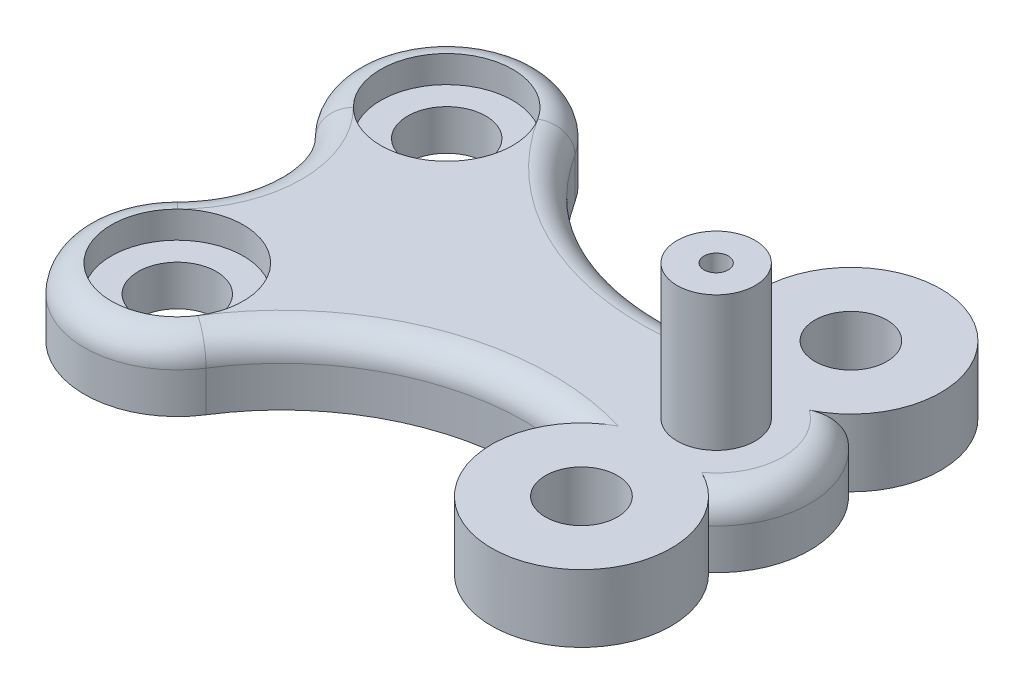
from build123d import *

# Parameters (mm, degrees)
CROQUIS2_R              = 1.45
CROQUIS2_R_2            = 1.335493539
SALIENTE_EXTRUIR1_DEPTH = 2.5
CROQUIS3_R              = 2.45
CORTAR_EXTRUIR1_DEPTH   = 1
CROQUIS4_R              = 1.45
CROQUIS4_R_2            = 0.45
SALIENTE_EXTRUIR2_DEPTH = 5
CROQUIS5_R              = 0.45
CORTAR_EXTRUIR2_DEPTH   = 21.921953183
REDONDEO1_R             = 1


with BuildPart() as part:
    # Croquis2 → Saliente-Extruir1 (new body)
    with BuildSketch(Plane(origin=(0, 0, 0), x_dir=(1, 0, 0), z_dir=(0, 1, 0))):
        with BuildLine():
            ThreePointArc((17.31117806, -2.595010785), (18.475, 0), (17.31117806, 2.595010785))
            ThreePointArc((17.31117806, 2.595010785), (15.166848951, 8.331317844), (12.46008331, 2.837977715))
            ThreePointArc((12.46008331, 2.837977715), (7.057861128, 3.344392229), (2.913938348, 6.8470147))
            ThreePointArc((2.913938348, 6.8470147), (-2.156353419, 7.693072582), (-2.439518395, 2.560481605))
            ThreePointArc((-2.439518395, 2.560481605), (-1.378932188, 0), (-2.439518395, -2.560481605))
            ThreePointArc((-2.439518395, -2.560481605), (-2.156353419, -7.693072582), (2.913938348, -6.8470147))
            ThreePointArc((2.913938348, -6.8470147), (7.057861128, -3.344392229), (12.46008331, -2.837977715))
            ThreePointArc((12.46008331, -2.837977715), (15.166848951, -8.331317844), (17.31117806, -2.595010785))
        make_face()
        with Locations(Location((0, 5, 0), (0, 0, 270))):
            Circle(CROQUIS2_R, mode=Mode.SUBTRACT)
        with Locations(Location((0, -5, 0), (0, 0, 90))):
            Circle(CROQUIS2_R, mode=Mode.SUBTRACT)
        with Locations(Location((15, -5, 0), (0, 0, 270))):
            Circle(CROQUIS2_R_2, mode=Mode.SUBTRACT)
        with Locations(Location((15, 5, 0), (0, 0, 90))):
            Circle(CROQUIS2_R_2, mode=Mode.SUBTRACT)
    extrude(amount=SALIENTE_EXTRUIR1_DEPTH)

    # Croquis3 → Cortar-Extruir1 (cut)
    with BuildSketch(Plane(origin=(0, 2.5, 0), x_dir=(1, 0, 0), z_dir=(0, 1, 0))):
        with Locations(Location((0, 5, 0), (0, 0, 270))):
            Circle(CROQUIS3_R)
        with Locations(Location((0, -5, 0), (0, 0, 270))):
            Circle(CROQUIS3_R)
    extrude(amount=-CORTAR_EXTRUIR1_DEPTH, mode=Mode.SUBTRACT)

    # Croquis4 → Saliente-Extruir2 (add)
    with BuildSketch(Plane(origin=(0, 2.5, 0), x_dir=(1, 0, 0), z_dir=(0, 1, 0))):
        with Locations(Location((15, 0, 0), (0, 0, 270))):
            Circle(CROQUIS4_R)
        with Locations(Location((15, 0, 0), (0, 0, 270))):
            Circle(CROQUIS4_R_2, mode=Mode.SUBTRACT)
    extrude(amount=SALIENTE_EXTRUIR2_DEPTH)

    # Croquis5 → Cortar-Extruir2 (cut, through all)
    with BuildSketch(Plane(origin=(0, 2.5, 0), x_dir=(1, 0, 0), z_dir=(0, 1, 0))):
        with Locations(Location((15, 0, 0), (0, 0, 270))):
            Circle(CROQUIS5_R)
    extrude(amount=-CORTAR_EXTRUIR2_DEPTH, mode=Mode.SUBTRACT)

    # Redondeo1
    # the kernel refuses this fillet: 1 mm, written as the material it takes off along each edge
    with BuildSketch(Plane(origin=(10.565709674, 2.5, 11.697129023), x_dir=(-0.8446198111127597, 0, -0.5353665797151015), z_dir=(-0.5353665797151015, 0, 0.8446198111127597))) as redondeo1_piece_1_section:
        with BuildLine():
            CenterArc((9.059426769 + REDONDEO1_R, REDONDEO1_R), REDONDEO1_R, 180, 90)
            Line((9.059426769, REDONDEO1_R), (9.059426769 - REDONDEO1_R * 0.02, REDONDEO1_R))
            Line((9.059426769 - REDONDEO1_R * 0.02, REDONDEO1_R), (9.059426769 - REDONDEO1_R * 0.02, -REDONDEO1_R * 0.02))
            Line((9.059426769 - REDONDEO1_R * 0.02, -REDONDEO1_R * 0.02), (9.059426769 + REDONDEO1_R, -REDONDEO1_R * 0.02))
            Line((9.059426769 + REDONDEO1_R, -REDONDEO1_R * 0.02), (9.059426769 + REDONDEO1_R, 0))
        make_face()
    redondeo1_piece_1 = revolve(axis=Axis((10.565709674, 2.5, 11.697129023), (0, -1, 0)), revolution_arc=85.516050129, mode=Mode.PRIVATE)
    redondeo1_piece_1 = redondeo1_piece_1 - Plane(origin=(15, 2.217210624, 5), x_dir=(-0.7614815197926343, 0, -0.6481866205147249), z_dir=(0, -1, 0)) * Cylinder(3.335493539, 41, mode=Mode.PRIVATE)
    add(redondeo1_piece_1, mode=Mode.SUBTRACT)
    with BuildSketch(Plane(origin=(15, 2.5, 0), x_dir=(0.007852951460832107, 0, 0.9999691651012815), z_dir=(-0.9999691651012815, 0, 0.007852951460832107))) as redondeo1_piece_2_section:
        with BuildLine():
            CenterArc((3.475 - REDONDEO1_R, -REDONDEO1_R), REDONDEO1_R, 0, 90)
            Line((3.475, -REDONDEO1_R), (3.475 + REDONDEO1_R * 0.02, -REDONDEO1_R))
            Line((3.475 + REDONDEO1_R * 0.02, -REDONDEO1_R), (3.475 + REDONDEO1_R * 0.02, REDONDEO1_R * 0.02))
            Line((3.475 + REDONDEO1_R * 0.02, REDONDEO1_R * 0.02), (3.475 - REDONDEO1_R, REDONDEO1_R * 0.02))
            Line((3.475 - REDONDEO1_R, REDONDEO1_R * 0.02), (3.475 - REDONDEO1_R, 0))
        make_face()
    redondeo1_piece_2 = revolve(axis=Axis((15, 2.5, 0), (0, 1, 0)), revolution_arc=179.1001088, mode=Mode.PRIVATE)
    redondeo1_piece_2 = redondeo1_piece_2 - Plane(origin=(15, 2.215042964, -5), x_dir=(0.6929043732212018, 0, 0.7210294928579091), z_dir=(0, -1, 0)) * Cylinder(3.335493539, 14, mode=Mode.PRIVATE)
    redondeo1_piece_2 = redondeo1_piece_2 - Plane(origin=(15, 2.215042964, 5), x_dir=(-0.7614815197926343, 0, -0.6481866205147249), z_dir=(0, -1, 0)) * Cylinder(3.335493539, 14, mode=Mode.PRIVATE)
    add(redondeo1_piece_2, mode=Mode.SUBTRACT)
    with BuildSketch(Plane(origin=(10.565709674, 2.5, -11.697129023), x_dir=(0.4676957368071937, 0, 0.883889528036381), z_dir=(0.883889528036381, 0, -0.4676957368071937))) as redondeo1_piece_3_section:
        with BuildLine():
            CenterArc((9.059426769 + REDONDEO1_R, REDONDEO1_R), REDONDEO1_R, 180, 90)
            Line((9.059426769 + REDONDEO1_R, 0), (9.059426769 + REDONDEO1_R, -REDONDEO1_R * 0.02))
            Line((9.059426769 + REDONDEO1_R, -REDONDEO1_R * 0.02), (9.059426769 - REDONDEO1_R * 0.02, -REDONDEO1_R * 0.02))
            Line((9.059426769 - REDONDEO1_R * 0.02, -REDONDEO1_R * 0.02), (9.059426769 - REDONDEO1_R * 0.02, REDONDEO1_R))
            Line((9.059426769 - REDONDEO1_R * 0.02, REDONDEO1_R), (9.059426769, REDONDEO1_R))
        make_face()
    redondeo1_piece_3 = revolve(axis=Axis((10.565709674, 2.5, -11.697129023), (0, -1, 0)), revolution_arc=85.516050129, mode=Mode.PRIVATE)
    redondeo1_piece_3 = redondeo1_piece_3 - Plane(origin=(15, 2.217210619, -5), x_dir=(0.6929043732212018, 0, 0.7210294928579091), z_dir=(0, -1, 0)) * Cylinder(3.335493539, 41, mode=Mode.PRIVATE)
    add(redondeo1_piece_3, mode=Mode.SUBTRACT)
    with BuildSketch(Plane(origin=(0, 2.5, -5), x_dir=(0.8446198111127605, 0, -0.5353665797151004), z_dir=(0.5353665797151004, 0, 0.8446198111127605))) as redondeo1_piece_4:
        with BuildLine():
            CenterArc((3.45 - REDONDEO1_R, -REDONDEO1_R), REDONDEO1_R, 0, 90)
            Line((3.45 - REDONDEO1_R, 0), (3.45 - REDONDEO1_R, REDONDEO1_R * 0.02))
            Line((3.45 - REDONDEO1_R, REDONDEO1_R * 0.02), (3.45 + REDONDEO1_R * 0.02, REDONDEO1_R * 0.02))
            Line((3.45 + REDONDEO1_R * 0.02, REDONDEO1_R * 0.02), (3.45 + REDONDEO1_R * 0.02, -REDONDEO1_R))
            Line((3.45 + REDONDEO1_R * 0.02, -REDONDEO1_R), (3.45, -REDONDEO1_R))
        make_face()
    revolve(axis=Axis((0, 2.5, -5), (0, 1, 0)), revolution_arc=192.631224639, mode=Mode.SUBTRACT)
    with BuildSketch(Plane(origin=(-5, 2.5, 0), x_dir=(0.7071067811865475, 0, -0.7071067811865476), z_dir=(-0.7071067811865476, 0, -0.7071067811865475))) as redondeo1_piece_5:
        with BuildLine():
            CenterArc((3.621067812 + REDONDEO1_R, REDONDEO1_R), REDONDEO1_R, 180, 90)
            Line((3.621067812 + REDONDEO1_R, 0), (3.621067812 + REDONDEO1_R, -REDONDEO1_R * 0.02))
            Line((3.621067812 + REDONDEO1_R, -REDONDEO1_R * 0.02), (3.621067812 - REDONDEO1_R * 0.02, -REDONDEO1_R * 0.02))
            Line((3.621067812 - REDONDEO1_R * 0.02, -REDONDEO1_R * 0.02), (3.621067812 - REDONDEO1_R * 0.02, REDONDEO1_R))
            Line((3.621067812 - REDONDEO1_R * 0.02, REDONDEO1_R), (3.621067812, REDONDEO1_R))
        make_face()
    revolve(axis=Axis((-5, 2.5, 0), (0, -1, 0)), revolution_arc=90, mode=Mode.SUBTRACT)
    with BuildSketch(Plane(origin=(0, 2.5, 5), x_dir=(-0.7071067811865475, 0, -0.7071067811865476), z_dir=(0.7071067811865476, 0, -0.7071067811865475))) as redondeo1_piece_6:
        with BuildLine():
            CenterArc((3.45 - REDONDEO1_R, -REDONDEO1_R), REDONDEO1_R, 0, 90)
            Line((3.45, -REDONDEO1_R), (3.45 + REDONDEO1_R * 0.02, -REDONDEO1_R))
            Line((3.45 + REDONDEO1_R * 0.02, -REDONDEO1_R), (3.45 + REDONDEO1_R * 0.02, REDONDEO1_R * 0.02))
            Line((3.45 + REDONDEO1_R * 0.02, REDONDEO1_R * 0.02), (3.45 - REDONDEO1_R, REDONDEO1_R * 0.02))
            Line((3.45 - REDONDEO1_R, REDONDEO1_R * 0.02), (3.45 - REDONDEO1_R, 0))
        make_face()
    revolve(axis=Axis((0, 2.5, 5), (0, 1, 0)), revolution_arc=192.631224639, mode=Mode.SUBTRACT)


solid = part.part
